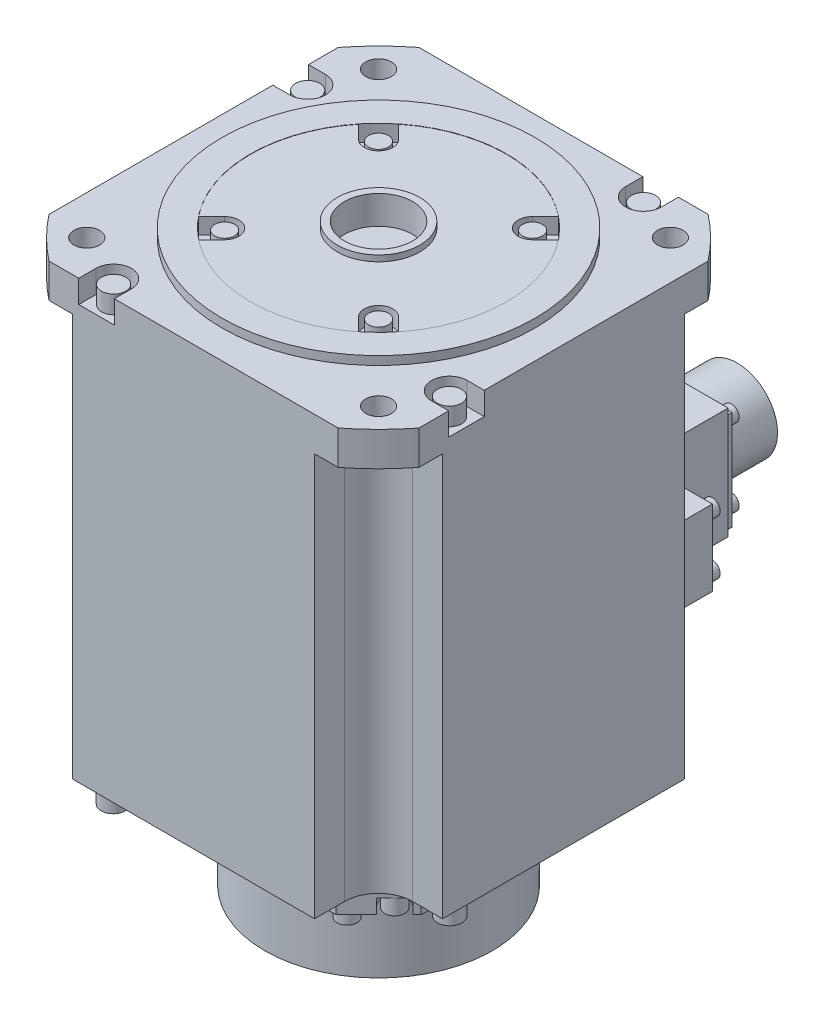
from build123d import *

# Parameters (mm, degrees)
SKETCH1_W                = 130
SKETCH1_H                = 153.5
BOSS_EXTRUDE1_DEPTH      = 65
CUT_EXTRUDE1_DEPTH       = 141.5
BOSS_EXTRUDE2_DEPTH      = 17.5
BOSS_EXTRUDE3_DEPTH      = 26
SKETCH5_R                = 55
BOSS_EXTRUDE4_DEPTH      = 3
SKETCH6_R                = 45
CUT_EXTRUDE2_DEPTH       = 0.1
SKETCH7_R                = 14.5
BOSS_EXTRUDE5_DEPTH      = 2.1
SKETCH8_R                = 12
CUT_EXTRUDE3_DEPTH       = 10
CUT_EXTRUDE4_DEPTH       = 8
CUT_EXTRUDE5_DEPTH       = 5.6
SKETCH11_W               = 58
SKETCH11_H               = 26.6
BOSS_EXTRUDE6_DEPTH      = 9.8
SKETCH12_W               = 37.7
SKETCH12_H               = 42.9
BOSS_EXTRUDE7_DEPTH      = 25.5
SKETCH13_W               = 37.7
SKETCH13_H               = 3.7
CUT_EXTRUDE6_DEPTH       = 11
SKETCH14_W               = 34.9
SKETCH14_H               = 34.9
BOSS_EXTRUDE8_DEPTH      = 2.75
SKETCH15_R               = 14.2
BOSS_EXTRUDE9_DEPTH      = 19.25
SKETCH16_W               = 27
SKETCH16_H               = 27
BOSS_EXTRUDE10_DEPTH     = 6.5
SKETCH17_W               = 23.4
SKETCH17_H               = 23.4
BOSS_EXTRUDE11_DEPTH     = 1.7
SKETCH18_R               = 7.65
BOSS_EXTRUDE12_DEPTH     = 6.7
SKETCH19_W               = 23.4
SKETCH19_H               = 23.4
BOSS_EXTRUDE13_DEPTH     = 1.7
SKETCH20_R               = 7.65
BOSS_EXTRUDE14_DEPTH     = 6.7
CUT_EXTRUDE7_DEPTH       = 5
CUT_EXTRUDE8_DEPTH       = 227.066914873
SKETCH23_R               = 4.25
BOSS_EXTRUDE15_DEPTH     = 6.3
SKETCH24_R               = 4.25
BOSS_EXTRUDE16_DEPTH     = 7.5
SKETCH25_R               = 3.5
BOSS_EXTRUDE17_DEPTH     = 4.4
SKETCH26_R               = 3.5
BOSS_EXTRUDE18_DEPTH     = 5.5
SKETCH27_R               = 2.475
BOSS_EXTRUDE19_DEPTH     = 2.88
SKETCH28_R               = 2.794850768
SKETCH28_R_2             = 2.75
BOSS_EXTRUDE20_DEPTH     = 3.5
SKETCH29_R               = 2.75
BOSS_EXTRUDE21_DEPTH     = 3.75
SKETCH30_R               = 2.75
BOSS_EXTRUDE22_DEPTH     = 1.942
SKETCH31_R               = 4.25
BOSS_EXTRUDE23_DEPTH     = 6.3
SKETCH32_R               = 3.5
BOSS_EXTRUDE24_DEPTH     = 5
F_9_0_9_DIAMETER_HOLE1_D = 9


with BuildPart() as part:
    # Sketch1 → Boss-Extrude1 (new, symmetric)
    with BuildSketch(Plane.XY):
        with Locations((0, 76.75)):
            Rectangle(SKETCH1_W, SKETCH1_H)
    extrude(amount=BOSS_EXTRUDE1_DEPTH, both=True)

    # Sketch2 → Cut-Extrude1 (cut)
    with BuildSketch(Plane.XZ):
        with BuildLine():
            Line((-42.5, 65), (-42.5, 54.5))
            ThreePointArc((-42.5, 54.5), (-46.014718626, 46.014718626), (-54.5, 42.5))
            Line((-54.5, 42.5), (-65, 42.5))
            Line((-65, 42.5), (-65, 65))
            Line((-65, 65), (-42.5, 65))
        make_face()
        with BuildLine():
            Line((65, 65), (42.5, 65))
            Line((42.5, 65), (42.5, 54.5))
            ThreePointArc((42.5, 54.5), (46.014718626, 46.014718626), (54.5, 42.5))
            Line((54.5, 42.5), (65, 42.5))
            Line((65, 42.5), (65, 65))
        make_face()
        with BuildLine():
            Line((42.5, -65), (42.5, -54.5))
            ThreePointArc((42.5, -54.5), (46.014718626, -46.014718626), (54.5, -42.5))
            Line((54.5, -42.5), (65, -42.5))
            Line((65, -42.5), (65, -65))
            Line((65, -65), (42.5, -65))
        make_face()
        with BuildLine():
            Line((-65, -65), (-42.5, -65))
            Line((-42.5, -65), (-42.5, -54.5))
            ThreePointArc((-42.5, -54.5), (-46.014718626, -46.014718626), (-54.5, -42.5))
            Line((-54.5, -42.5), (-65, -42.5))
            Line((-65, -42.5), (-65, -65))
        make_face()
    extrude(amount=-CUT_EXTRUDE1_DEPTH, mode=Mode.SUBTRACT)

    # Sketch3 → Boss-Extrude2 (add)
    with BuildSketch(Plane.XZ):
        Polygon((-42.5, 27.5), (-27.5, 42.5), (27.5, 42.5), (42.5, 27.5), (42.5, -27.5), (27.5, -42.5), (-27.5, -42.5), (-42.5, -27.5), align=None)
    extrude(amount=BOSS_EXTRUDE2_DEPTH)

    # Sketch4 → Boss-Extrude3 (add)
    with BuildSketch(Plane.XZ.offset(17.5)):
        with BuildLine():
            Line((-12, -38.157568057), (-12, -42.5))
            Line((-12, -42.5), (12, -42.5))
            Line((12, -42.5), (12, -38.157568057))
            ThreePointArc((12, -38.157568057), (0, 40), (-12, -38.157568057))
        make_face()
    extrude(amount=BOSS_EXTRUDE3_DEPTH)

    # Sketch5 → Boss-Extrude4 (add)
    with BuildSketch(Plane(origin=(0, 153.5, 0), x_dir=(1, 0, 0), z_dir=(0, 1, 0))):
        Circle(SKETCH5_R)
    extrude(amount=BOSS_EXTRUDE4_DEPTH)

    # Sketch6 → Cut-Extrude2 (cut)
    with BuildSketch(Plane(origin=(0, 156.5, 0), x_dir=(1, 0, 0), z_dir=(0, 1, 0))):
        Circle(SKETCH6_R)
    extrude(amount=-CUT_EXTRUDE2_DEPTH, mode=Mode.SUBTRACT)

    # Sketch7 → Boss-Extrude5 (add)
    with BuildSketch(Plane(origin=(0, 156.4, 0), x_dir=(1, 0, 0), z_dir=(0, 1, 0))):
        Circle(SKETCH7_R)
    extrude(amount=BOSS_EXTRUDE5_DEPTH)

    # Sketch8 → Cut-Extrude3 (cut)
    with BuildSketch(Plane(origin=(0, 158.5, 0), x_dir=(1, 0, 0), z_dir=(0, 1, 0))):
        Circle(SKETCH8_R)
    extrude(amount=-CUT_EXTRUDE3_DEPTH, mode=Mode.SUBTRACT)

    # Sketch9 → Cut-Extrude4 (cut)
    with BuildSketch(Plane(origin=(0, 153.5, 0), x_dir=(1, 0, 0), z_dir=(0, 1, 0))):
        with BuildLine():
            Line((-40.35, -65), (-40.35, -59))
            ThreePointArc((-40.35, -59), (-34.1, -52.75), (-27.85, -59))
            Line((-27.85, -59), (-27.85, -65))
            Line((-27.85, -65), (-40.35, -65))
        make_face()
        with BuildLine():
            Line((-59, 27.85), (-65, 27.85))
            Line((-65, 27.85), (-65, 40.35))
            Line((-65, 40.35), (-59, 40.35))
            ThreePointArc((-59, 40.35), (-52.75, 34.1), (-59, 27.85))
        make_face()
        with BuildLine():
            Line((27.85, 59), (27.85, 65))
            Line((27.85, 65), (40.35, 65))
            Line((40.35, 65), (40.35, 59))
            ThreePointArc((40.35, 59), (34.1, 52.75), (27.85, 59))
        make_face()
        with BuildLine():
            Line((59, -27.85), (65, -27.85))
            Line((65, -27.85), (65, -40.35))
            Line((65, -40.35), (59, -40.35))
            ThreePointArc((59, -40.35), (52.75, -34.1), (59, -27.85))
        make_face()
    extrude(amount=-CUT_EXTRUDE4_DEPTH, mode=Mode.SUBTRACT)

    # Sketch10 → Cut-Extrude5 (cut)
    with BuildSketch(Plane(origin=(0, 156.4, 0), x_dir=(1, 0, 0), z_dir=(0, 1, 0))):
        with BuildLine():
            Line((-35.158310508, 28.087242696), (-30.582368286, 23.511300474))
            ThreePointArc((-30.582368286, 23.511300474), (-23.511300474, 23.511300474), (-23.511300474, 30.582368286))
            Line((-23.511300474, 30.582368286), (-28.087242696, 35.158310508))
            ThreePointArc((-28.087242696, 35.158310508), (-31.819805153, 31.819805153), (-35.158310508, 28.087242696))
        make_face()
        with BuildLine():
            Line((28.087242696, 35.158310508), (23.511300474, 30.582368286))
            ThreePointArc((23.511300474, 30.582368286), (23.511300474, 23.511300474), (30.582368286, 23.511300474))
            Line((30.582368286, 23.511300474), (35.158310508, 28.087242696))
            ThreePointArc((35.158310508, 28.087242696), (31.819805153, 31.819805153), (28.087242696, 35.158310508))
        make_face()
        with BuildLine():
            Line((35.158310508, -28.087242696), (30.582368286, -23.511300474))
            ThreePointArc((30.582368286, -23.511300474), (23.511300474, -23.511300474), (23.511300474, -30.582368286))
            Line((23.511300474, -30.582368286), (28.087242696, -35.158310508))
            ThreePointArc((28.087242696, -35.158310508), (31.819805153, -31.819805153), (35.158310508, -28.087242696))
        make_face()
        with BuildLine():
            Line((-28.087242696, -35.158310508), (-23.511300474, -30.582368286))
            ThreePointArc((-23.511300474, -30.582368286), (-23.511300474, -23.511300474), (-30.582368286, -23.511300474))
            Line((-30.582368286, -23.511300474), (-35.158310508, -28.087242696))
            ThreePointArc((-35.158310508, -28.087242696), (-31.819805153, -31.819805153), (-28.087242696, -35.158310508))
        make_face()
    extrude(amount=-CUT_EXTRUDE5_DEPTH, mode=Mode.SUBTRACT)

    # Sketch11 → Boss-Extrude6 (add)
    with BuildSketch(Plane(origin=(0, 0, -65), x_dir=(-1, 0, 0), z_dir=(0, 0, -1))):
        with Locations((-13.5, 43)):
            Rectangle(SKETCH11_W, SKETCH11_H)
    extrude(amount=BOSS_EXTRUDE6_DEPTH)

    # Sketch12 → Boss-Extrude7 (add)
    with BuildSketch(Plane(origin=(0, 0, -65), x_dir=(-1, 0, 0), z_dir=(0, 0, -1))):
        with Locations((-13.5, 51.15)):
            Rectangle(SKETCH12_W, SKETCH12_H)
    extrude(amount=BOSS_EXTRUDE7_DEPTH)

    # Sketch13 → Cut-Extrude6 (cut)
    with BuildSketch(Plane(origin=(0, 0, -90.5), x_dir=(-1, 0, 0), z_dir=(0, 0, -1))):
        with Locations((-13.5, 31.55)):
            Rectangle(SKETCH13_W, SKETCH13_H)
    extrude(amount=-CUT_EXTRUDE6_DEPTH, mode=Mode.SUBTRACT)

    # Sketch14 → Boss-Extrude8 (add)
    with BuildSketch(Plane(origin=(0, 0, -90.5), x_dir=(-1, 0, 0), z_dir=(0, 0, -1))):
        with Locations((-13.5, 51.7)):
            Rectangle(SKETCH14_W, SKETCH14_H)
    extrude(amount=BOSS_EXTRUDE8_DEPTH)

    # Sketch15 → Boss-Extrude9 (add)
    with BuildSketch(Plane(origin=(0, 0, -93.25), x_dir=(-1, 0, 0), z_dir=(0, 0, -1))):
        with Locations((-13.5, 51.7)):
            Circle(SKETCH15_R)
    extrude(amount=BOSS_EXTRUDE9_DEPTH)

    # Sketch16 → Boss-Extrude10 (add)
    with BuildSketch(Plane(origin=(0, 0, -65), x_dir=(-1, 0, 0), z_dir=(0, 0, -1))):
        with Locations((29, 15.5)):
            Rectangle(SKETCH16_W, SKETCH16_H)
    extrude(amount=BOSS_EXTRUDE10_DEPTH)

    # Sketch17 → Boss-Extrude11 (add)
    with BuildSketch(Plane(origin=(0, 0, -71.5), x_dir=(-1, 0, 0), z_dir=(0, 0, -1))):
        with Locations((29, 15.5)):
            Rectangle(SKETCH17_W, SKETCH17_H)
    extrude(amount=BOSS_EXTRUDE11_DEPTH)

    # Sketch18 → Boss-Extrude12 (add)
    with BuildSketch(Plane(origin=(0, 0, -73.2), x_dir=(-1, 0, 0), z_dir=(0, 0, -1))):
        with Locations((29, 15.5)):
            Circle(SKETCH18_R)
    extrude(amount=BOSS_EXTRUDE12_DEPTH)

    # Sketch19 → Boss-Extrude13 (add)
    with BuildSketch(Plane(origin=(0, 0, -42.5), x_dir=(-1, 0, 0), z_dir=(0, 0, -1))):
        with Locations((0, -30.5)):
            Rectangle(SKETCH19_W, SKETCH19_H)
    extrude(amount=BOSS_EXTRUDE13_DEPTH)

    # Sketch20 → Boss-Extrude14 (add)
    with BuildSketch(Plane(origin=(0, 0, -44.2), x_dir=(-1, 0, 0), z_dir=(0, 0, -1))):
        with Locations((0, -30.5)):
            Circle(SKETCH20_R)
    extrude(amount=BOSS_EXTRUDE14_DEPTH)

    # Sketch21 → Cut-Extrude7 (cut)
    with BuildSketch(Plane.XZ.offset(17.5)):
        with BuildLine():
            Line((-28.983115196, 41.016884804), (-26.386219485, 38.419989092))
            ThreePointArc((-26.386219485, 38.419989092), (-26.386219485, 32.056028061), (-32.750180515, 32.056028061))
            Line((-32.750180515, 32.056028061), (-35.347076227, 34.652923773))
            Line((-35.347076227, 34.652923773), (-28.983115196, 41.016884804))
        make_face()
        with BuildLine():
            Line((32.056028061, 32.750180515), (34.652923773, 35.347076227))
            Line((34.652923773, 35.347076227), (41.016884804, 28.983115196))
            Line((41.016884804, 28.983115196), (38.419989092, 26.386219485))
            ThreePointArc((38.419989092, 26.386219485), (32.056028061, 26.386219485), (32.056028061, 32.750180515))
        make_face()
        with BuildLine():
            Line((32.750180515, -32.056028061), (35.347076227, -34.652923773))
            Line((35.347076227, -34.652923773), (28.983115196, -41.016884804))
            Line((28.983115196, -41.016884804), (26.386219485, -38.419989092))
            ThreePointArc((26.386219485, -38.419989092), (26.386219485, -32.056028061), (32.750180515, -32.056028061))
        make_face()
        with BuildLine():
            Line((-32.056028061, -32.750180515), (-34.652923773, -35.347076227))
            Line((-34.652923773, -35.347076227), (-41.016884804, -28.983115196))
            Line((-41.016884804, -28.983115196), (-38.419989092, -26.386219485))
            ThreePointArc((-38.419989092, -26.386219485), (-32.056028061, -26.386219485), (-32.056028061, -32.750180515))
        make_face()
    extrude(amount=-CUT_EXTRUDE7_DEPTH, mode=Mode.SUBTRACT)

    # Sketch22 → Cut-Extrude8 (cut, through all)
    with BuildSketch(Plane.XZ.offset(-141.5)):
        with BuildLine():
            Line((65, 50.806003582), (65, 65))
            Line((65, 65), (50.806003582, 65))
            ThreePointArc((50.806003582, 65), (58.336309448, 58.336309448), (65, 50.806003582))
        make_face()
        with BuildLine():
            Line((-50.806003582, 65), (-65, 65))
            Line((-65, 65), (-65, 50.806003582))
            ThreePointArc((-65, 50.806003582), (-58.336309448, 58.336309448), (-50.806003582, 65))
        make_face()
        with BuildLine():
            Line((-65, -50.806003582), (-65, -65))
            Line((-65, -65), (-50.806003582, -65))
            ThreePointArc((-50.806003582, -65), (-58.336309448, -58.336309448), (-65, -50.806003582))
        make_face()
        with BuildLine():
            Line((50.806003582, -65), (65, -65))
            Line((65, -65), (65, -50.806003582))
            ThreePointArc((65, -50.806003582), (58.336309448, -58.336309448), (50.806003582, -65))
        make_face()
    extrude(amount=-CUT_EXTRUDE8_DEPTH, mode=Mode.SUBTRACT)

    # Sketch23 → Boss-Extrude15 (add)
    with BuildSketch(Plane.XZ):
        with Locations((-34.1, 59.1)):
            Circle(SKETCH23_R)
        with Locations((59.1, 34.1)):
            Circle(SKETCH23_R)
        with Locations((34.1, -59.1)):
            Circle(SKETCH23_R)
        with Locations((-59.1, -34.1)):
            Circle(SKETCH23_R)
    extrude(amount=BOSS_EXTRUDE15_DEPTH)

    # Sketch24 → Boss-Extrude16 (add)
    with BuildSketch(Plane.XZ):
        with Locations((50.228142967, -13.458590345)):
            Circle(SKETCH24_R)
        with Locations((0, 52)):
            Circle(SKETCH24_R)
        with Locations((-50.228142967, -13.458590345)):
            Circle(SKETCH24_R)
    extrude(amount=BOSS_EXTRUDE16_DEPTH)

    # Sketch25 → Boss-Extrude17 (add)
    with BuildSketch(Plane.XZ.offset(17.5)):
        with Locations((25.8109, 36.8618)):
            Circle(SKETCH25_R)
        with Locations((36.8618, -25.8109)):
            Circle(SKETCH25_R)
        with Locations((-25.8109, -36.8618)):
            Circle(SKETCH25_R)
        with Locations((-36.8618, 25.8109)):
            Circle(SKETCH25_R)
    extrude(amount=BOSS_EXTRUDE17_DEPTH)

    # Sketch26 → Boss-Extrude18 (add)
    with BuildSketch(Plane.XZ.offset(12.5)):
        with Locations((35.238008577, 29.5682)):
            Circle(SKETCH26_R)
        with Locations((29.5682, -35.238008577)):
            Circle(SKETCH26_R)
        with Locations((-35.238008577, -29.5682)):
            Circle(SKETCH26_R)
        with Locations((-29.5682, 35.238008577)):
            Circle(SKETCH26_R)
    extrude(amount=BOSS_EXTRUDE18_DEPTH)

    # Sketch27 → Boss-Extrude19 (add)
    with BuildSketch(Plane(origin=(0, 0, -44.2), x_dir=(-1, 0, 0), z_dir=(0, 0, -1))):
        with Locations((8.63, -21.87)):
            Circle(SKETCH27_R)
        with Locations((8.63, -39.13)):
            Circle(SKETCH27_R)
        with Locations((-8.63, -39.13)):
            Circle(SKETCH27_R)
        with Locations((-8.63, -21.87)):
            Circle(SKETCH27_R)
    extrude(amount=BOSS_EXTRUDE19_DEPTH)

    # Sketch28 → Boss-Extrude20 (add)
    with BuildSketch(Plane(origin=(0, 0, -74.8), x_dir=(-1, 0, 0), z_dir=(0, 0, -1))):
        with Locations((12, 52)):
            Circle(SKETCH28_R)
        with Locations((12, 33)):
            Circle(SKETCH28_R_2)
        with Locations((-39, 33)):
            Circle(SKETCH28_R_2)
        with Locations((-39, 52)):
            Circle(SKETCH28_R_2)
    extrude(amount=BOSS_EXTRUDE20_DEPTH)

    # Sketch29 → Boss-Extrude21 (add)
    with BuildSketch(Plane(origin=(0, 0, -93.25), x_dir=(-1, 0, 0), z_dir=(0, 0, -1))):
        with Locations((-0.015, 65.185)):
            Circle(SKETCH29_R)
        with Locations((-0.015, 38.215)):
            Circle(SKETCH29_R)
        with Locations((-26.985, 38.215)):
            Circle(SKETCH29_R)
        with Locations((-26.985, 65.185)):
            Circle(SKETCH29_R)
    extrude(amount=BOSS_EXTRUDE21_DEPTH)

    # Sketch30 → Boss-Extrude22 (add)
    with BuildSketch(Plane(origin=(0, 0, -73.2), x_dir=(-1, 0, 0), z_dir=(0, 0, -1))):
        with Locations((37.63, 24.13)):
            Circle(SKETCH30_R)
        with Locations((37.63, 6.87)):
            Circle(SKETCH30_R)
        with Locations((20.37, 6.87)):
            Circle(SKETCH30_R)
        with Locations((20.37, 24.13)):
            Circle(SKETCH30_R)
    extrude(amount=BOSS_EXTRUDE22_DEPTH)

    # Sketch31 → Boss-Extrude23 (add)
    with BuildSketch(Plane(origin=(0, 145.5, 0), x_dir=(1, 0, 0), z_dir=(0, 1, 0))):
        with Locations((34.1, 59)):
            Circle(SKETCH31_R)
        with Locations((59, -34.1)):
            Circle(SKETCH31_R)
        with Locations((-59, 34.1)):
            Circle(SKETCH31_R)
        with Locations((-34.1, -59)):
            Circle(SKETCH31_R)
    extrude(amount=BOSS_EXTRUDE23_DEPTH)

    # Sketch32 → Boss-Extrude24 (add)
    with BuildSketch(Plane(origin=(0, 150.8, 0), x_dir=(1, 0, 0), z_dir=(0, 1, 0))):
        with Locations((-27.04683438, 27.04683438)):
            Circle(SKETCH32_R)
        with Locations((27.04683438, 27.04683438)):
            Circle(SKETCH32_R)
        with Locations((27.04683438, -27.04683438)):
            Circle(SKETCH32_R)
        with Locations((-27.04683438, -27.04683438)):
            Circle(SKETCH32_R)
    extrude(amount=BOSS_EXTRUDE24_DEPTH)

    # Ø9.0 (9) Diameter Hole1 (through all)
    with Locations(Plane(origin=(0, 153.5, 0), x_dir=(-1, 0, 0), z_dir=(0, 1, 0))):
        with Locations((-51.265241636, 51.265241636), (51.265241636, 51.265241636), (51.265241636, -51.265241636), (-51.265241636, -51.265241636)):
            Hole(F_9_0_9_DIAMETER_HOLE1_D / 2)


solid = part.part
